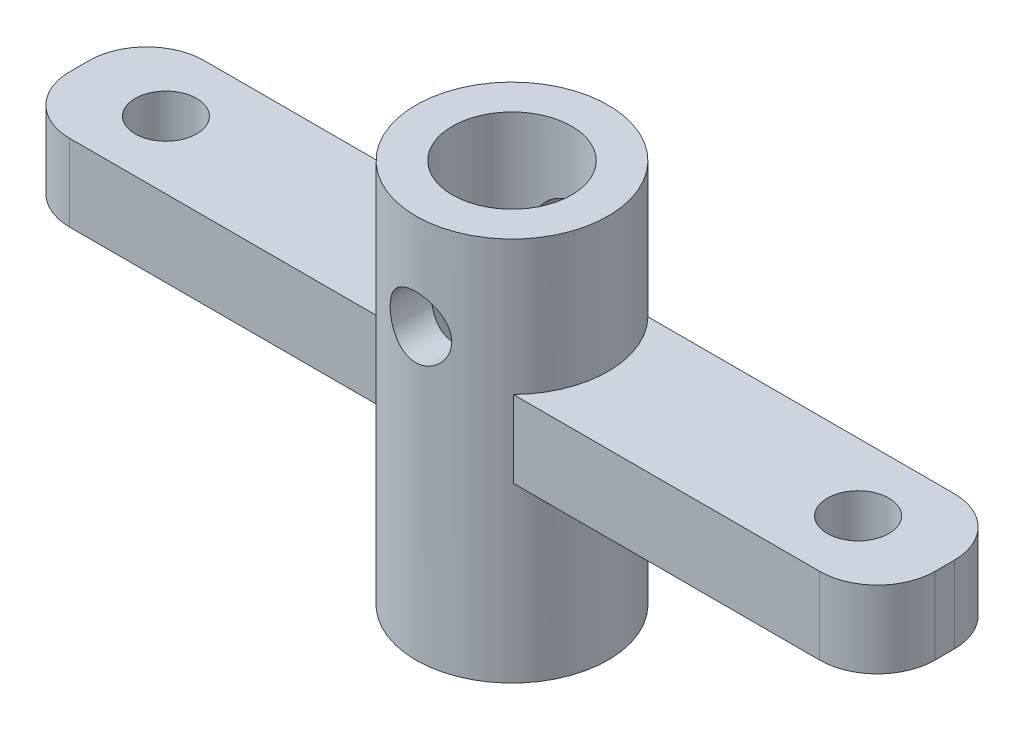
from build123d import *

# Parameters (mm, degrees)
SKETCH_1_R               = 5
SKETCH_1_R_2             = 3.1
EXTRUDE_1_DEPTH          = 20
SKETCH_2_W               = 45
SKETCH_2_H               = 4
EXTRUDE_2_DEPTH          = 3.5
SKETCH_4_R               = 1.6
CUT_EXTRUDE_2_DEPTH      = 27.462237245
FILLET_1_R               = 3
CUT_EXTRUDE_3_DEPTH      = 31.516389039
CUT_EXTRUDE_3_DEPTH_BACK = 31.516389039
SKETCH_5_R               = 1.6
CUT_EXTRUDE_4_DEPTH      = 27.462237313
CUT_EXTRUDE_4_DEPTH_BACK = 27.462237313
SKETCH_3_R               = 3.1


with BuildPart() as part:
    # 草图1 → 凸台-拉伸1 (new body)
    with BuildSketch(Plane(origin=(0, 0, 0), x_dir=(1, 0, 0), z_dir=(0, 1, 0))):
        Circle(SKETCH_1_R)
        Circle(SKETCH_1_R_2, mode=Mode.SUBTRACT)
    extrude(amount=EXTRUDE_1_DEPTH)

    # 草图2 → 凸台-拉伸2 (add, symmetric)
    with BuildSketch(Plane.XY):
        with Locations((0, 11)):
            Rectangle(SKETCH_2_W, SKETCH_2_H)
    extrude(amount=EXTRUDE_2_DEPTH, both=True)

    # 草图4 → 切除-拉伸2 (cut, through all)
    with BuildSketch(Plane(origin=(0, 13, 0), x_dir=(1, 0, 0), z_dir=(0, 1, 0))):
        with Locations((-18, 0)):
            Circle(SKETCH_4_R)
        with Locations((18, 0)):
            Circle(SKETCH_4_R)
    extrude(amount=-CUT_EXTRUDE_2_DEPTH, mode=Mode.SUBTRACT)

    # 圆角1
    fillet_1_edges = [part.edges().sort_by_distance(p)[0] for p in [
        (22.5, 11, -3.5),
        (22.5, 11, 3.5),
        (-22.5, 11, -3.5),
        (-22.5, 11, 3.5),
    ]]
    fillet(fillet_1_edges, radius=FILLET_1_R)

    # 草图5 → 切除-拉伸3 (cut, two sides: drawn at the far end of the back side and taken through both)
    with BuildSketch(Plane.XY.offset(-CUT_EXTRUDE_3_DEPTH_BACK)):
        with Locations((0, 15)):
            Circle(SKETCH_5_R)
    extrude(amount=CUT_EXTRUDE_3_DEPTH + CUT_EXTRUDE_3_DEPTH_BACK, mode=Mode.SUBTRACT)

    # 草图3 → 切除-拉伸4 (cut, two sides: drawn at the far end of the back side and taken through both)
    with BuildSketch(Plane(origin=(0, 13, 0), x_dir=(1, 0, 0), z_dir=(0, 1, 0)).offset(-CUT_EXTRUDE_4_DEPTH_BACK)):
        Circle(SKETCH_3_R)
    extrude(amount=CUT_EXTRUDE_4_DEPTH + CUT_EXTRUDE_4_DEPTH_BACK, mode=Mode.SUBTRACT)


solid = part.part
